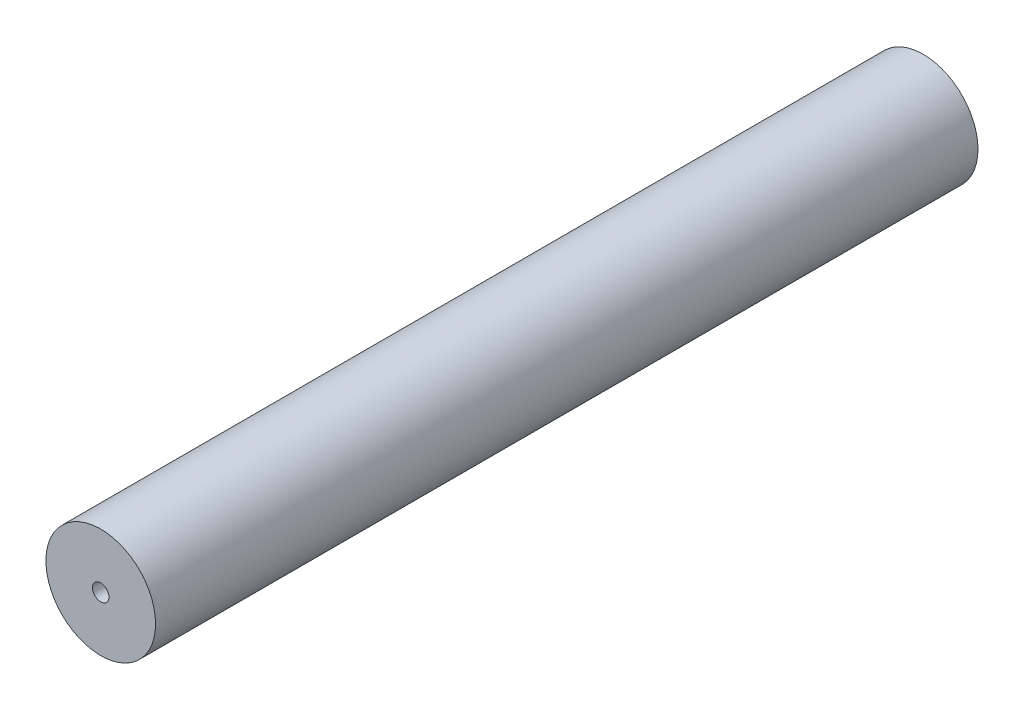
from build123d import *

# Parameters (mm, degrees)
SKETCH1_R           = 20
BOSS_EXTRUDE1_DEPTH = 300
SKETCH3_R           = 3
CUT_EXTRUDE1_DEPTH  = 20


with BuildPart() as part:
    # Sketch1 → Boss-Extrude1 (new body)
    with BuildSketch(Plane.XY):
        Circle(SKETCH1_R)
    extrude(amount=BOSS_EXTRUDE1_DEPTH)

    # Sketch3 → Cut-Extrude1 (cut)
    with BuildSketch(Plane.XY.offset(300)):
        Circle(SKETCH3_R)
    extrude(amount=-CUT_EXTRUDE1_DEPTH, mode=Mode.SUBTRACT)


solid = part.part
